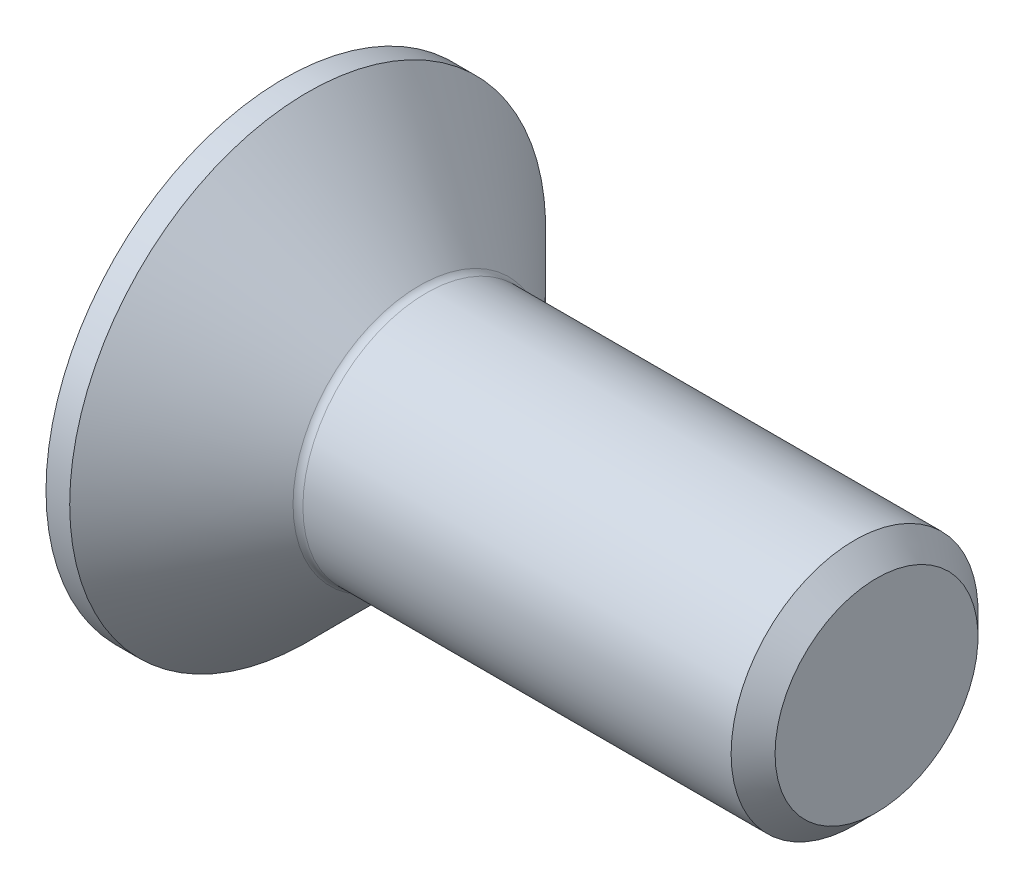
from build123d import *

# Parameters (mm, degrees)
FILLET1_R   = 0.2
HEX_START   = -2.3
HEX_2_DEPTH = 2.3


with BuildPart() as part:
    # BodySke → BaseBody (revolve)
    with BuildSketch(Plane.XY, mode=Mode.PRIVATE) as basebody_sk:
        Polygon((0, 0), (0, 4.82), (0.48, 4.82), (2.8, 2.5), (11.555, 2.5), (12, 2.055), (12, 0), align=None)
    revolve(basebody_sk.sketch.rotate(Axis((0, 0, 0), (1, 0, 0)), 90), axis=Axis((0, 0, 0), (1, 0, 0)))

    # Fillet1
    fillet1_edges = [part.edges().sort_by_distance(p)[0] for p in [
        (2.8, 0, -2.5),
    ]]
    fillet(fillet1_edges, radius=FILLET1_R)

    # Hex 2: read off the stored shape, not the designer's step
    # Hex 2 outline → Hex 2 (cut)
    with BuildSketch(Plane.ZY.offset(HEX_START)):
        Polygon((-1.51, -0.871798906), (0, -1.743597813), (1.51, -0.871798906), (1.51, 0.871798906), (0, 1.743597813), (-1.51, 0.871798906), align=None)
    extrude(amount=HEX_2_DEPTH, mode=Mode.SUBTRACT)

    # Hex 2 2 outline → Hex 2 2 (revolve, cut)
    with BuildSketch(Plane.YX):
        Polygon((1.51, 2.3), (0, 3.171798906), (0, 2.3), align=None)
    revolve(axis=Axis((0, 0, 0), (1, 0, 0)), mode=Mode.SUBTRACT)


solid = part.part
